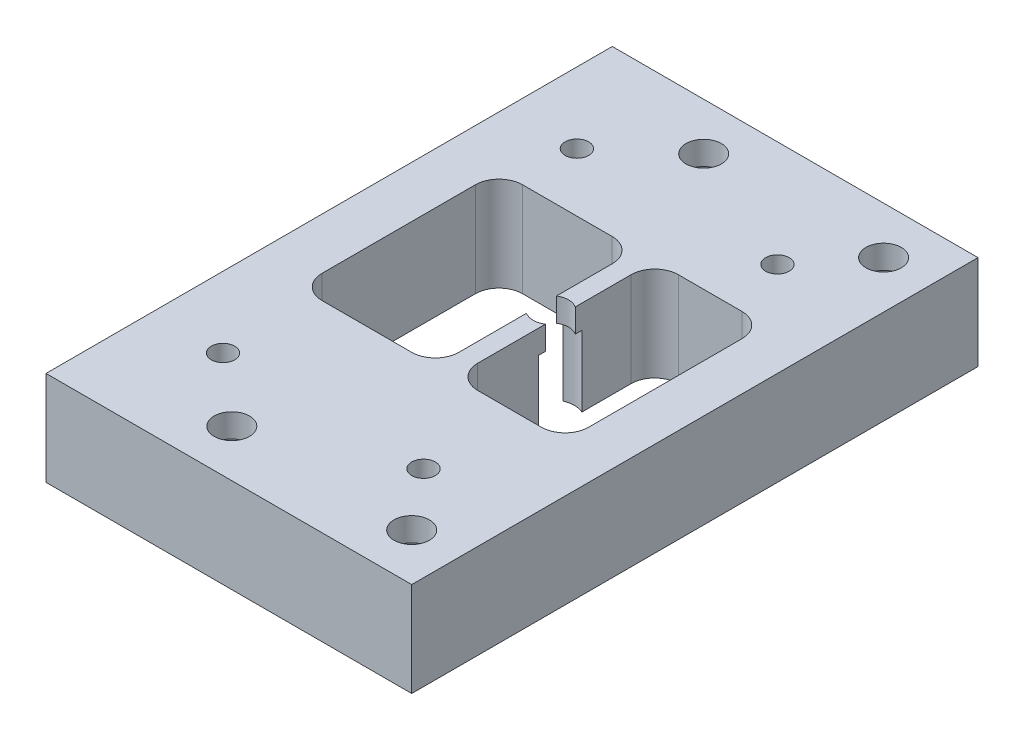
from build123d import *

# Parameters (mm, degrees)
SKETCH1_W              = 155
SKETCH1_H              = 240
BOSS_EXTRUDE1_DEPTH    = 40
CUT_EXTRUDE1_REACH     = 150.345
SKETCH3_W              = 58
SKETCH3_H              = 85
SKETCH3_W_2            = 47
FILLET1_R              = 10
SKETCH7_R              = 7.5
CUT_EXTRUDE4_DEPTH     = 370.927853642
SKETCH8_R              = 10
CUT_EXTRUDE5_DEPTH     = 30
M10_TAPPED_HOLE1_D     = 8.5
M10_TAPPED_HOLE1_DEPTH = 24.5
M10_TAPPED_HOLE1_TIP   = 2.553657631
F_10_0MM_DOWEL_HOLE1_D = 10
CUT_EXTRUDE6_REACH     = 150.345
SKETCH15_R             = 7.5
SKETCH16_R             = 9
CUT_EXTRUDE7_DEPTH     = 30


with BuildPart() as part:
    # Sketch1 → Boss-Extrude1 (new body)
    with BuildSketch(Plane(origin=(0, 0, 0), x_dir=(1, 0, 0), z_dir=(0, 1, 0))):
        Rectangle(SKETCH1_W, SKETCH1_H)
    extrude(amount=-BOSS_EXTRUDE1_DEPTH)

    # Sketch3 → Cut-Extrude1 (cut, up to next)
    with BuildSketch(Plane(origin=(0, 0, 0), x_dir=(1, 0, 0), z_dir=(0, 1, 0)), mode=Mode.PRIVATE) as cut_extrude1_sk1:
        with Locations((-26.75, 7.73)):
            Rectangle(SKETCH3_W, SKETCH3_H)
    cut_extrude1_tool1 = extrude(cut_extrude1_sk1.sketch, amount=-CUT_EXTRUDE1_REACH, mode=Mode.PRIVATE) & part.part
    # Sketch3 → Cut-Extrude1 (cut, up to next)
    with BuildSketch(Plane(origin=(0, 0, 0), x_dir=(1, 0, 0), z_dir=(0, 1, 0)), mode=Mode.PRIVATE) as cut_extrude1_sk2:
        with Locations((33.75, 7.73)):
            Rectangle(SKETCH3_W_2, SKETCH3_H)
    cut_extrude1_tool2 = extrude(cut_extrude1_sk2.sketch, amount=-CUT_EXTRUDE1_REACH, mode=Mode.PRIVATE) & part.part
    add(cut_extrude1_tool1.solids().sort_by_distance((-26.75, 0, -7.73))[0], mode=Mode.SUBTRACT)
    add(cut_extrude1_tool2.solids().sort_by_distance((33.75, 0, -7.73))[0], mode=Mode.SUBTRACT)

    # Fillet1
    fillet1_edges = [part.edges().sort_by_distance(p)[0] for p in [
        (10.25, -20, -50.23),
        (57.25, -20, 34.77),
        (57.25, -20, -50.23),
        (10.25, -20, 34.77),
        (-55.75, -20, 34.77),
        (2.25, -20, 34.77),
        (2.25, -20, -50.23),
        (-55.75, -20, -50.23),
    ]]
    fillet(fillet1_edges, radius=FILLET1_R)

    # Sketch7 → Cut-Extrude4 (cut, through all)
    with BuildSketch(Plane(origin=(270.13, 0, 0), x_dir=(1, 0, 0), z_dir=(0, 1, 0))):
        with Locations((-263.88, 10.23)):
            Circle(SKETCH7_R)
    extrude(amount=-CUT_EXTRUDE4_DEPTH, mode=Mode.SUBTRACT)

    # Sketch8 → Cut-Extrude5 (cut)
    with BuildSketch(Plane(origin=(270.13, -40, 0), x_dir=(1, 0, 0), z_dir=(0, -1, 0))):
        with Locations((-263.88, -10.23)):
            Circle(SKETCH8_R)
    extrude(amount=-CUT_EXTRUDE5_DEPTH, mode=Mode.SUBTRACT)

    # M10 Tapped Hole1
    with Locations(Plane(origin=(0, -40, 0), x_dir=(-1, 0, 0), z_dir=(0, -1, 0))):
        with Locations((-65, 75), (65, 75), (65, -75), (-65, -75)):
            Hole(M10_TAPPED_HOLE1_D / 2, depth=M10_TAPPED_HOLE1_DEPTH)
            with Locations((0, 0, -(M10_TAPPED_HOLE1_DEPTH + M10_TAPPED_HOLE1_TIP / 2))):  # 118° drill point
                Cone(0, M10_TAPPED_HOLE1_D / 2, M10_TAPPED_HOLE1_TIP, mode=Mode.SUBTRACT)

    # Ø10.0mm Dowel Hole1 (through all)
    with Locations(Plane(origin=(0, -40, 0), x_dir=(-1, 0, 0), z_dir=(0, -1, 0))):
        with Locations((-37.5, 75), (-37.5, -75), (47.5, -75), (47.5, 75)):
            Hole(F_10_0MM_DOWEL_HOLE1_D / 2)

    # Sketch15 → Cut-Extrude6 (cut, up to next)
    with BuildSketch(Plane(origin=(0, 0, 0), x_dir=(1, 0, 0), z_dir=(0, 1, 0)), mode=Mode.PRIVATE) as cut_extrude6_sk1:
        with Locations((57.5, -100)):
            Circle(SKETCH15_R)
    cut_extrude6_tool1 = extrude(cut_extrude6_sk1.sketch, amount=-CUT_EXTRUDE6_REACH, mode=Mode.PRIVATE) & part.part
    # Sketch15 → Cut-Extrude6 (cut, up to next)
    with BuildSketch(Plane(origin=(0, 0, 0), x_dir=(1, 0, 0), z_dir=(0, 1, 0)), mode=Mode.PRIVATE) as cut_extrude6_sk2:
        with Locations((-18.75, -100)):
            Circle(SKETCH15_R)
    cut_extrude6_tool2 = extrude(cut_extrude6_sk2.sketch, amount=-CUT_EXTRUDE6_REACH, mode=Mode.PRIVATE) & part.part
    # Sketch15 → Cut-Extrude6 (cut, up to next)
    with BuildSketch(Plane(origin=(0, 0, 0), x_dir=(1, 0, 0), z_dir=(0, 1, 0)), mode=Mode.PRIVATE) as cut_extrude6_sk3:
        with Locations((57.5, 100)):
            Circle(SKETCH15_R)
    cut_extrude6_tool3 = extrude(cut_extrude6_sk3.sketch, amount=-CUT_EXTRUDE6_REACH, mode=Mode.PRIVATE) & part.part
    # Sketch15 → Cut-Extrude6 (cut, up to next)
    with BuildSketch(Plane(origin=(0, 0, 0), x_dir=(1, 0, 0), z_dir=(0, 1, 0)), mode=Mode.PRIVATE) as cut_extrude6_sk4:
        with Locations((-18.75, 100)):
            Circle(SKETCH15_R)
    cut_extrude6_tool4 = extrude(cut_extrude6_sk4.sketch, amount=-CUT_EXTRUDE6_REACH, mode=Mode.PRIVATE) & part.part
    add(cut_extrude6_tool1.solids().sort_by_distance((57.5, 0, 100))[0], mode=Mode.SUBTRACT)
    add(cut_extrude6_tool2.solids().sort_by_distance((-18.75, 0, 100))[0], mode=Mode.SUBTRACT)
    add(cut_extrude6_tool3.solids().sort_by_distance((57.5, 0, -100))[0], mode=Mode.SUBTRACT)
    add(cut_extrude6_tool4.solids().sort_by_distance((-18.75, 0, -100))[0], mode=Mode.SUBTRACT)

    # Sketch16 → Cut-Extrude7 (cut)
    with BuildSketch(Plane.XZ.offset(40)):
        with Locations((-18.75, -100)):
            Circle(SKETCH16_R)
        with Locations((57.5, -100)):
            Circle(SKETCH16_R)
        with Locations((57.5, 100)):
            Circle(SKETCH16_R)
        with Locations((-18.75, 100)):
            Circle(SKETCH16_R)
    extrude(amount=-CUT_EXTRUDE7_DEPTH, mode=Mode.SUBTRACT)


solid = part.part
